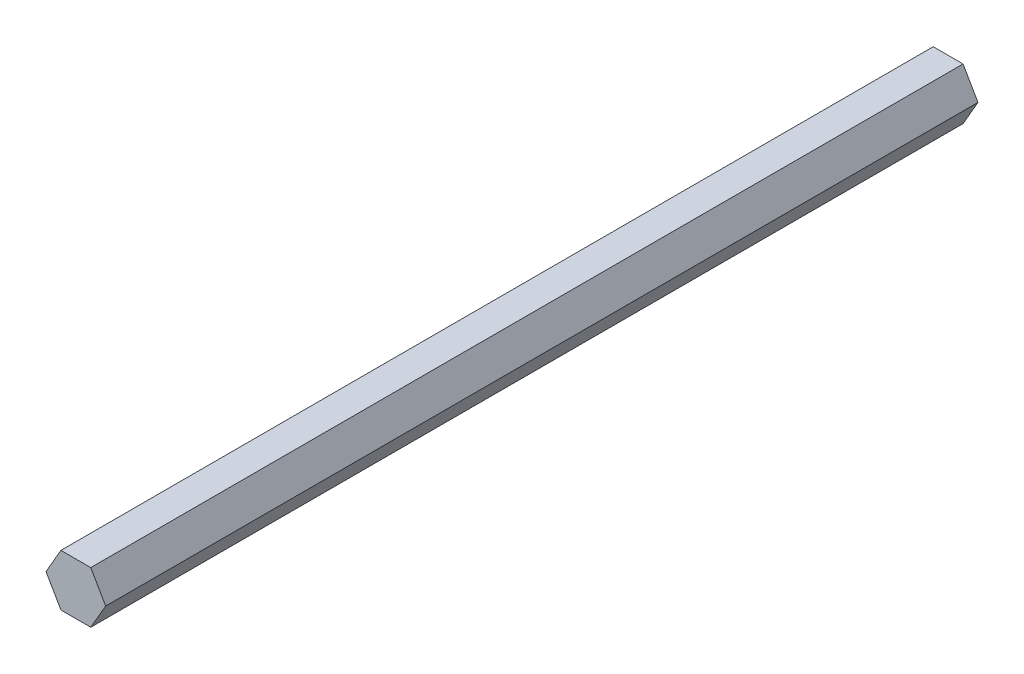
from build123d import *

# Parameters (mm, degrees)
BOSS_EXTRUDE1_DEPTH = 214.3125


with BuildPart() as part:
    # Sketch1 → Boss-Extrude1 (new body)
    with BuildSketch(Plane.XY):
        Polygon((-7.332348419, 0), (-3.666174209, -6.35), (3.666174209, -6.35), (7.332348419, 0), (3.666174209, 6.35), (-3.666174209, 6.35), align=None)
    extrude(amount=BOSS_EXTRUDE1_DEPTH)


solid = part.part
